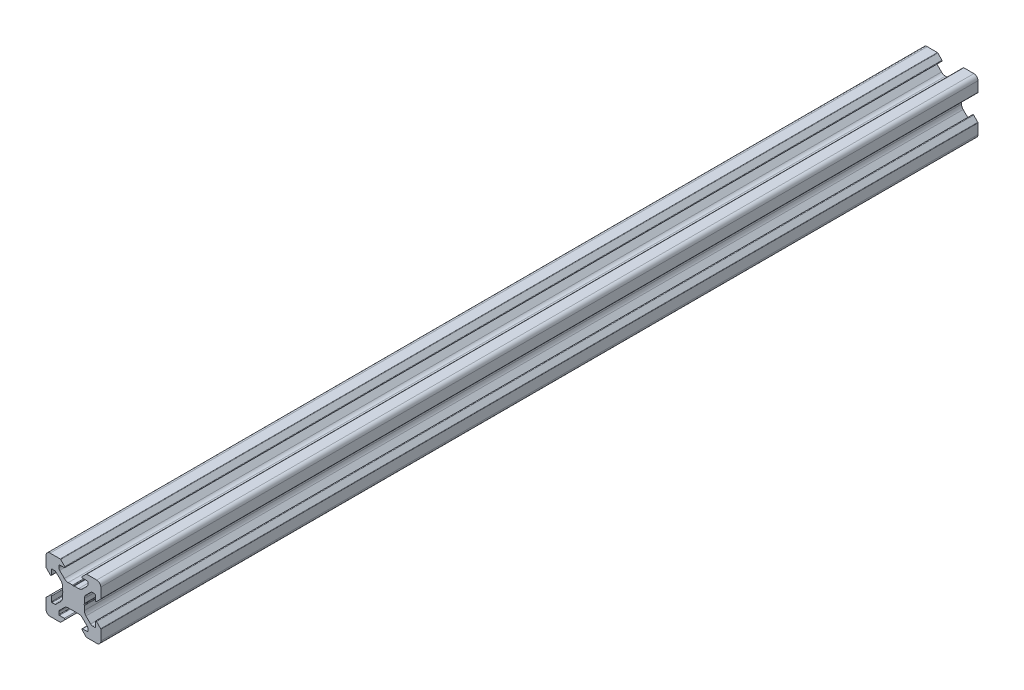
from build123d import *

# Parameters (mm, degrees)
EXTRUDE_1_DEPTH = 320


# Read off the part's stored shape, not the designer's step: 222 Конструкционный профиль 20х20-1-surface1
with BuildPart() as part:
    # Эскиз1 → Бобышка-Вытянуть1 (new body)
    with BuildSketch(Plane.XY):
        with BuildLine():
            Line((-3.945217202, 0.181521503), (-3.8, 0))
            Line((-3.8, 0), (-3.945217202, -0.181521503))
            ThreePointArc((-3.945217202, -0.181521503), (-3.98590708, -0.254943529), (-4, -0.337695265))
            Line((-4, -0.337695265), (-4, -1.898780669))
            ThreePointArc((-4, -1.898780669), (-4.152240935, -2.664147534), (-4.585786438, -3.312994231))
            Line((-4.585786438, -3.312994231), (-6.279898987, -5.007106781))
            ThreePointArc((-6.279898987, -5.007106781), (-6.604322336, -5.223879533), (-6.987005769, -5.3))
            Line((-6.987005769, -5.3), (-7.8, -5.3))
            ThreePointArc((-7.8, -5.3), (-7.941421356, -5.241421356), (-8, -5.1))
            Line((-8, -5.1), (-8, -3.33))
            ThreePointArc((-8, -3.33), (-8.154329142, -3.099030117), (-8.426776695, -3.153223305))
            Line((-8.426776695, -3.153223305), (-9.926776695, -4.653223305))
            ThreePointArc((-9.926776695, -4.653223305), (-9.980969883, -4.734329142), (-10, -4.83))
            Line((-10, -4.83), (-10, -8.5))
            ThreePointArc((-10, -8.5), (-9.560660172, -9.560660172), (-8.5, -10))
            Line((-8.5, -10), (-4.83, -10))
            ThreePointArc((-4.83, -10), (-4.734329142, -9.980969883), (-4.653223305, -9.926776695))
            Line((-4.653223305, -9.926776695), (-3.153223305, -8.426776695))
            ThreePointArc((-3.153223305, -8.426776695), (-3.099030117, -8.154329142), (-3.33, -8))
            Line((-3.33, -8), (-5.1, -8))
            ThreePointArc((-5.1, -8), (-5.241421356, -7.941421356), (-5.3, -7.8))
            Line((-5.3, -7.8), (-5.3, -6.987005769))
            ThreePointArc((-5.3, -6.987005769), (-5.223879533, -6.604322336), (-5.007106781, -6.279898987))
            Line((-5.007106781, -6.279898987), (-3.312994231, -4.585786438))
            ThreePointArc((-3.312994231, -4.585786438), (-2.664147534, -4.152240935), (-1.898780669, -4))
            Line((-1.898780669, -4), (-0.337695265, -4))
            ThreePointArc((-0.337695265, -4), (-0.254943529, -3.98590708), (-0.181521503, -3.945217202))
            Line((-0.181521503, -3.945217202), (0, -3.8))
            Line((0, -3.8), (0.181521503, -3.945217202))
            ThreePointArc((0.181521503, -3.945217202), (0.254943529, -3.98590708), (0.337695265, -4))
            Line((0.337695265, -4), (1.898780669, -4))
            ThreePointArc((1.898780669, -4), (2.664147534, -4.152240935), (3.312994231, -4.585786438))
            Line((3.312994231, -4.585786438), (5.007106781, -6.279898987))
            ThreePointArc((5.007106781, -6.279898987), (5.223879533, -6.604322336), (5.3, -6.987005769))
            Line((5.3, -6.987005769), (5.3, -7.8))
            ThreePointArc((5.3, -7.8), (5.241421356, -7.941421356), (5.1, -8))
            Line((5.1, -8), (3.33, -8))
            ThreePointArc((3.33, -8), (3.099030117, -8.154329142), (3.153223305, -8.426776695))
            Line((3.153223305, -8.426776695), (4.653223305, -9.926776695))
            ThreePointArc((4.653223305, -9.926776695), (4.734329142, -9.980969883), (4.83, -10))
            Line((4.83, -10), (8.5, -10))
            ThreePointArc((8.5, -10), (9.560660172, -9.560660172), (10, -8.5))
            Line((10, -8.5), (10, -4.83))
            ThreePointArc((10, -4.83), (9.980969883, -4.734329142), (9.926776695, -4.653223305))
            Line((9.926776695, -4.653223305), (8.426776695, -3.153223305))
            ThreePointArc((8.426776695, -3.153223305), (8.154329142, -3.099030117), (8, -3.33))
            Line((8, -3.33), (8, -5.1))
            ThreePointArc((8, -5.1), (7.941421356, -5.241421356), (7.8, -5.3))
            Line((7.8, -5.3), (6.987005769, -5.3))
            ThreePointArc((6.987005769, -5.3), (6.604322336, -5.223879533), (6.279898987, -5.007106781))
            Line((6.279898987, -5.007106781), (4.585786438, -3.312994231))
            ThreePointArc((4.585786438, -3.312994231), (4.152240935, -2.664147534), (4, -1.898780669))
            Line((4, -1.898780669), (4, -0.337695265))
            ThreePointArc((4, -0.337695265), (3.98590708, -0.254943529), (3.945217202, -0.181521503))
            Line((3.945217202, -0.181521503), (3.8, 0))
            Line((3.8, 0), (3.945217202, 0.181521503))
            ThreePointArc((3.945217202, 0.181521503), (3.98590708, 0.254943529), (4, 0.337695265))
            Line((4, 0.337695265), (4, 1.898780669))
            ThreePointArc((4, 1.898780669), (4.152240935, 2.664147534), (4.585786438, 3.312994231))
            Line((4.585786438, 3.312994231), (6.279898987, 5.007106781))
            ThreePointArc((6.279898987, 5.007106781), (6.604322336, 5.223879533), (6.987005769, 5.3))
            Line((6.987005769, 5.3), (7.8, 5.3))
            ThreePointArc((7.8, 5.3), (7.941421356, 5.241421356), (8, 5.1))
            Line((8, 5.1), (8, 3.33))
            ThreePointArc((8, 3.33), (8.154329142, 3.099030117), (8.426776695, 3.153223305))
            Line((8.426776695, 3.153223305), (9.926776695, 4.653223305))
            ThreePointArc((9.926776695, 4.653223305), (9.980969883, 4.734329142), (10, 4.83))
            Line((10, 4.83), (10, 8.5))
            ThreePointArc((10, 8.5), (9.560660172, 9.560660172), (8.5, 10))
            Line((8.5, 10), (4.83, 10))
            ThreePointArc((4.83, 10), (4.734329142, 9.980969883), (4.653223305, 9.926776695))
            Line((4.653223305, 9.926776695), (3.153223305, 8.426776695))
            ThreePointArc((3.153223305, 8.426776695), (3.099030117, 8.154329142), (3.33, 8))
            Line((3.33, 8), (5.1, 8))
            ThreePointArc((5.1, 8), (5.241421356, 7.941421356), (5.3, 7.8))
            Line((5.3, 7.8), (5.3, 6.987005769))
            ThreePointArc((5.3, 6.987005769), (5.223879533, 6.604322336), (5.007106781, 6.279898987))
            Line((5.007106781, 6.279898987), (3.312994231, 4.585786438))
            ThreePointArc((3.312994231, 4.585786438), (2.664147534, 4.152240935), (1.898780669, 4))
            Line((1.898780669, 4), (0.337695265, 4))
            ThreePointArc((0.337695265, 4), (0.254943529, 3.98590708), (0.181521503, 3.945217202))
            Line((0.181521503, 3.945217202), (0, 3.8))
            Line((0, 3.8), (-0.181521503, 3.945217202))
            ThreePointArc((-0.181521503, 3.945217202), (-0.254943529, 3.98590708), (-0.337695265, 4))
            Line((-0.337695265, 4), (-1.898780669, 4))
            ThreePointArc((-1.898780669, 4), (-2.664147534, 4.152240935), (-3.312994231, 4.585786438))
            Line((-3.312994231, 4.585786438), (-5.007106781, 6.279898987))
            ThreePointArc((-5.007106781, 6.279898987), (-5.223879533, 6.604322336), (-5.3, 6.987005769))
            Line((-5.3, 6.987005769), (-5.3, 7.8))
            ThreePointArc((-5.3, 7.8), (-5.241421356, 7.941421356), (-5.1, 8))
            Line((-5.1, 8), (-3.33, 8))
            ThreePointArc((-3.33, 8), (-3.099030117, 8.154329142), (-3.153223305, 8.426776695))
            Line((-3.153223305, 8.426776695), (-4.653223305, 9.926776695))
            ThreePointArc((-4.653223305, 9.926776695), (-4.734329142, 9.980969883), (-4.83, 10))
            Line((-4.83, 10), (-8.5, 10))
            ThreePointArc((-8.5, 10), (-9.560660172, 9.560660172), (-10, 8.5))
            Line((-10, 8.5), (-10, 4.83))
            ThreePointArc((-10, 4.83), (-9.980969883, 4.734329142), (-9.926776695, 4.653223305))
            Line((-9.926776695, 4.653223305), (-8.426776695, 3.153223305))
            ThreePointArc((-8.426776695, 3.153223305), (-8.154329142, 3.099030117), (-8, 3.33))
            Line((-8, 3.33), (-8, 5.1))
            ThreePointArc((-8, 5.1), (-7.941421356, 5.241421356), (-7.8, 5.3))
            Line((-7.8, 5.3), (-6.987005769, 5.3))
            ThreePointArc((-6.987005769, 5.3), (-6.604322336, 5.223879533), (-6.279898987, 5.007106781))
            Line((-6.279898987, 5.007106781), (-4.585786438, 3.312994231))
            ThreePointArc((-4.585786438, 3.312994231), (-4.152240935, 2.664147534), (-4, 1.898780669))
            Line((-4, 1.898780669), (-4, 0.337695265))
            ThreePointArc((-4, 0.337695265), (-3.98590708, 0.254943529), (-3.945217202, 0.181521503))
        make_face()
    extrude(amount=EXTRUDE_1_DEPTH)


solid = part.part
